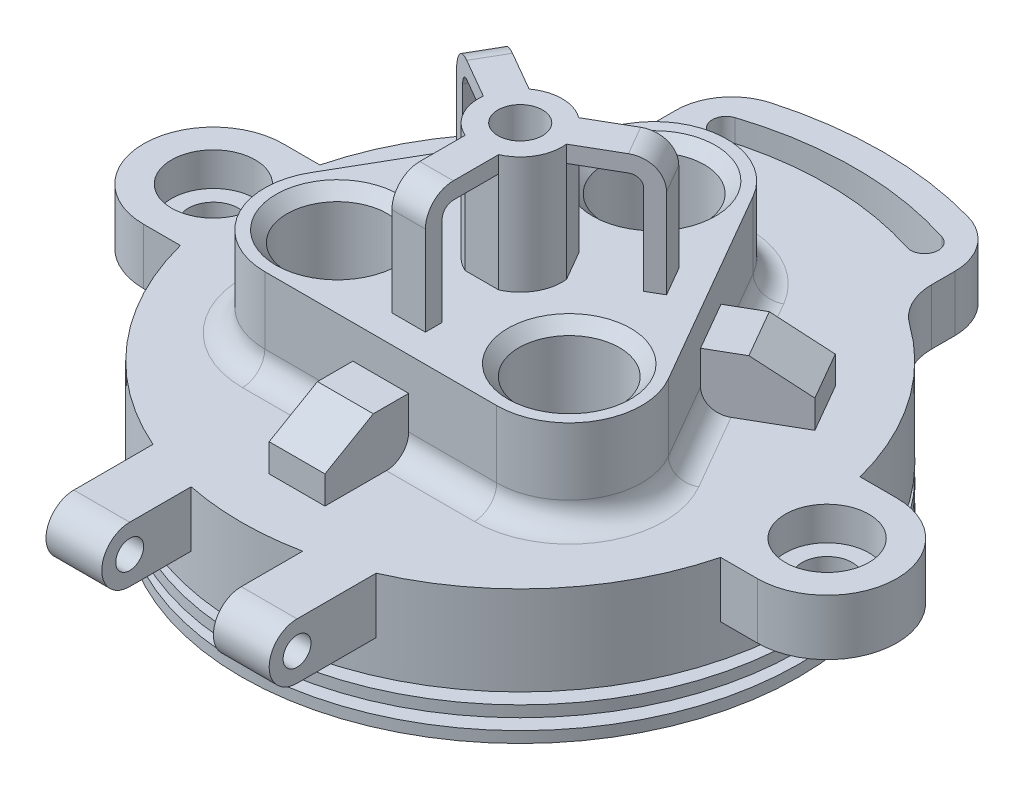
from build123d import *
from build123d.topology import SkipClean

# Parameters (mm, degrees)
BOSS_EXTRUDE1_DEPTH                              = 10
SKETCH3_R                                        = 9
BOSS_EXTRUDE2_DEPTH                              = 16
FILLET1_R                                        = 4
CHAMFER1_SIZE                                    = 2
BOSS_EXTRUDE3_START                              = 10
SKETCH5_R                                        = 13
BOSS_EXTRUDE3_DEPTH                              = 10
CUT_EXTRUDE1_DEPTH                               = 94.03897033
CUT_EXTRUDE1_DEPTH_BACK                          = 94.03897033
SKETCH4_R                                        = 9
CIRPATTERN1_COUNT                                = 3
CUT_EXTRUDE2_DEPTH                               = 94.03897033
CUT_EXTRUDE2_DEPTH_BACK                          = 94.03897033
SKETCH7_R                                        = 9
CBORE_FOR_M8_HEX_HEAD_MACHINE_SCREW1_D           = 9
CBORE_FOR_M8_HEX_HEAD_MACHINE_SCREW1_CBORE_D     = 15
CBORE_FOR_M8_HEX_HEAD_MACHINE_SCREW1_CBORE_DEPTH = 6
SKETCH11_W                                       = 3
SKETCH11_H                                       = 2
BOSS_EXTRUDE4_DEPTH                              = 5
CIRPATTERN2_COUNT                                = 3
SKETCH14_R                                       = 2.5
BOSS_EXTRUDE5_DEPTH                              = 10
BOSS_EXTRUDE6_START                              = -10
BOSS_EXTRUDE6_DEPTH                              = 10
SKETCH16_R                                       = 7.5
BOSS_EXTRUDE7_DEPTH                              = 21
CUT_EXTRUDE4_DEPTH                               = 112.813460728
CUT_EXTRUDE4_DEPTH_BACK                          = 112.813460728
SKETCH17_R                                       = 4
BOSS_EXTRUDE9_DEPTH                              = 3
CUT_EXTRUDE5_DEPTH                               = 3
CIRPATTERN3_COUNT                                = 3
FILLET6_R                                        = 10
FILLET7_R                                        = 10
FILLET8_R                                        = 10
FILLET9_R                                        = 10


with BuildPart() as part:
    # Sketch1 → Revolve1 (revolve)
    with BuildSketch(Plane.XY, mode=Mode.PRIVATE) as revolve1_sk:
        Polygon((0, 0), (50, 0), (50, -24), (45, -24), (45, -9), (0, -9), align=None)
    revolve(revolve1_sk.sketch.rotate(Axis((0, -30.388235294, 0), (0, 1, 0)), 90), axis=Axis((0, -30.388235294, 0), (0, 1, 0)))

    # Sketch2 → Boss-Extrude1 (add)
    with BuildSketch(Plane(origin=(0, 0, 0), x_dir=(1, 0, 0), z_dir=(0, 1, 0))):
        with BuildLine():
            Line((-48.412291828, 12.5), (-55, 12.5))
            ThreePointArc((-55, 12.5), (-67.5, 0), (-55, -12.5))
            Line((-55, -12.5), (-48.412291828, -12.5))
            Line((-48.412291828, -12.5), (-48.412291828, 12.5))
        make_face()
        with BuildLine():
            Line((48.412291828, -12.5), (48.412291828, 12.5))
            Line((48.412291828, 12.5), (55, 12.5))
            ThreePointArc((55, 12.5), (67.5, 0), (55, -12.5))
            Line((55, -12.5), (48.412291828, -12.5))
        make_face()
    extrude(amount=-BOSS_EXTRUDE1_DEPTH)

    # Sketch3 → Boss-Extrude2 (add)
    with BuildSketch(Plane(origin=(0, 0, 0), x_dir=(1, 0, 0), z_dir=(0, 1, 0))):
        with BuildLine():
            Line((32.04293994, -5.5), (11.258330249, 30.5))
            ThreePointArc((11.258330249, 30.5), (0, 37), (-11.258330249, 30.5))
            Line((-11.258330249, 30.5), (-32.04293994, -5.5))
            ThreePointArc((-32.04293994, -5.5), (-32.04293994, -18.5), (-20.784609691, -25))
            Line((-20.784609691, -25), (20.784609691, -25))
            ThreePointArc((20.784609691, -25), (32.04293994, -18.5), (32.04293994, -5.5))
        make_face()
        with Locations(Location((0, 24, 0), (0, 0, 270))):
            Circle(SKETCH3_R, mode=Mode.SUBTRACT)
        with Locations(Location((20.784609691, -12, 0), (0, 0, 270))):
            Circle(SKETCH3_R, mode=Mode.SUBTRACT)
        with Locations(Location((-20.784609691, -12, 0), (0, 0, 270))):
            Circle(SKETCH3_R, mode=Mode.SUBTRACT)
    extrude(amount=BOSS_EXTRUDE2_DEPTH)

    # Fillet1
    fillet1_edges = [part.edges().sort_by_distance(p)[0] for p in [
        (0, 0, -37),
        (-21.650635095, 0, -12.5),
        (-32.04293994, 0, 18.5),
        (0, 0, 25),
        (32.04293994, 0, 18.5),
        (21.650635095, 0, -12.5),
    ]]
    fillet(fillet1_edges, radius=FILLET1_R)

    # Chamfer1
    chamfer1_edges = [part.edges().sort_by_distance(p)[0] for p in [
        (20.784609691, 16, 3),
        (0, 16, -33),
        (-20.784609691, 16, 3),
    ]]
    chamfer(chamfer1_edges, length=CHAMFER1_SIZE)

    # Sketch5 → Boss-Extrude3 (add)
    with BuildSketch(Plane.XZ.offset(9).offset(BOSS_EXTRUDE3_START)):
        with Locations(Location((-20.784609691, 12, 0), (0, 0, 270))):
            Circle(SKETCH5_R)
    boss_extrude3 = extrude(amount=-BOSS_EXTRUDE3_DEPTH)

    # Sketch4 → Cut-Extrude1 (cut, two sides: drawn at the far end of the back side and taken through both)
    with SkipClean():  # the faces are left unmerged after this step: merging them gives an invalid solid
        with BuildSketch(Plane(origin=(0, 16, 0), x_dir=(1, 0, 0), z_dir=(0, 1, 0)).offset(-CUT_EXTRUDE1_DEPTH_BACK)):
            with Locations(Location((0, 24, 0), (0, 0, 90))):
                Circle(SKETCH4_R)
            with Locations(Location((20.784609691, -12, 0), (0, 0, 90))):
                Circle(SKETCH4_R)
            with Locations(Location((-20.784609691, -12, 0), (0, 0, 90))):
                Circle(SKETCH4_R)
        extrude(amount=CUT_EXTRUDE1_DEPTH + CUT_EXTRUDE1_DEPTH_BACK, mode=Mode.SUBTRACT)

    # CirPattern1: Boss-Extrude3 ×3 about axis
    with SkipClean():  # the faces are left unmerged after this step: merging them gives an invalid solid
        cirpattern1_axis = Axis((0, 0, 0), (0, 1, 0))
        for i in range(1, CIRPATTERN1_COUNT):
            add(boss_extrude3.rotate(cirpattern1_axis, i * 360 / CIRPATTERN1_COUNT))

    # Sketch7 → Cut-Extrude2 (cut, two sides: drawn at the far end of the back side and taken through both)
    with SkipClean():  # the faces are left unmerged after this step: merging them gives an invalid solid
        with BuildSketch(Plane(origin=(0, 16, 0), x_dir=(1, 0, 0), z_dir=(0, 1, 0)).offset(-CUT_EXTRUDE2_DEPTH_BACK)):
            with Locations(Location((0, 24, 0), (0, 0, 90))):
                Circle(SKETCH7_R)
            with Locations(Location((20.784609691, -12, 0), (0, 0, 90))):
                Circle(SKETCH7_R)
        extrude(amount=CUT_EXTRUDE2_DEPTH + CUT_EXTRUDE2_DEPTH_BACK, mode=Mode.SUBTRACT)

    # CBORE for M8 Hex Head Machine Screw1 (through all)
    with Locations(Plane(origin=(0, 0, 0), x_dir=(1, 0, 0), z_dir=(0, 1, 0))):
        with Locations((-55, 0), (55, 0)):
            CounterBoreHole(CBORE_FOR_M8_HEX_HEAD_MACHINE_SCREW1_D / 2, CBORE_FOR_M8_HEX_HEAD_MACHINE_SCREW1_CBORE_D / 2, CBORE_FOR_M8_HEX_HEAD_MACHINE_SCREW1_CBORE_DEPTH)

    # Sketch11 → Cut-Revolve1 (revolve, cut)
    with SkipClean():  # the faces are left unmerged after this step: merging them gives an invalid solid
        with BuildSketch(Plane.XY, mode=Mode.PRIVATE) as cut_revolve1_sk:
            with Locations((-48.5, -17)):
                Rectangle(SKETCH11_W, SKETCH11_H)
            with Locations((-48.5, -21)):
                Rectangle(SKETCH11_W, SKETCH11_H)
        revolve(cut_revolve1_sk.sketch.rotate(Axis((0, 0, 0), (0, -1, 0)), 270), axis=Axis((0, 0, 0), (0, -1, 0)), mode=Mode.SUBTRACT)

    # Sketch12 → Boss-Extrude4 (add, symmetric)
    with SkipClean():  # the faces are left unmerged after this step: merging them gives an invalid solid
        with BuildSketch(Plane(origin=(0, 0, 0), x_dir=(0, 0, -1), z_dir=(1, 0, 0))):
            Polygon((-25, 10), (-31.339745962, 10), (-40, 5), (-40, 0), (-25, 0), align=None)
        boss_extrude4 = extrude(amount=BOSS_EXTRUDE4_DEPTH, both=True)

    # CirPattern2: Boss-Extrude4 ×3 about axis
    with SkipClean():  # the faces are left unmerged after this step: merging them gives an invalid solid
        cirpattern2_axis = Axis((0, 0, 0), (0, 1, 0))
        for i in range(1, CIRPATTERN2_COUNT):
            add(boss_extrude4.rotate(cirpattern2_axis, i * 360 / CIRPATTERN2_COUNT))

    # Sketch14 → Boss-Extrude5 (add)
    with SkipClean():  # the faces are left unmerged after this step: merging them gives an invalid solid
        with BuildSketch(Plane(origin=(10, 0, 0), x_dir=(0, 0, -1), z_dir=(1, 0, 0))):
            with BuildLine():
                Line((-60, 0), (-45, 0))
                Line((-45, 0), (-45, -10))
                Line((-45, -10), (-60, -10))
                ThreePointArc((-60, -10), (-65, -5), (-60, 0))
            make_face()
            with Locations((-60, -5)):
                Circle(SKETCH14_R, mode=Mode.SUBTRACT)
        boss_extrude5 = extrude(amount=BOSS_EXTRUDE5_DEPTH)

    # Mirror1: Boss-Extrude5 across plane
    with SkipClean():  # the faces are left unmerged after this step: merging them gives an invalid solid
        add(boss_extrude5.mirror(Plane(origin=(0, 0, 0), x_dir=(0, 0, 1), z_dir=(1, 0, 0))))

    # Sketch15 → Boss-Extrude6 (add)
    with SkipClean():  # the faces are left unmerged after this step: merging them gives an invalid solid
        with BuildSketch(Plane(origin=(0, 0, 0), x_dir=(1, 0, 0), z_dir=(0, 1, 0)).offset(BOSS_EXTRUDE6_START)):
            with BuildLine():
                Line((-25, 43.301270189), (-25, 60))
                ThreePointArc((-25, 60), (0, 65), (25, 60))
                Line((25, 60), (25, 43.301270189))
                ThreePointArc((25, 43.301270189), (0, 50), (-25, 43.301270189))
            make_face()
            with BuildLine():
                ThreePointArc((18.541019662, 57.063390978), (0, 60), (-18.541019662, 57.063390978))
                ThreePointArc((-18.541019662, 57.063390978), (-20.146118467, 53.913207201), (-16.995934691, 52.308108396))
                ThreePointArc((-16.995934691, 52.308108396), (0, 55), (16.995934691, 52.308108396))
                ThreePointArc((16.995934691, 52.308108396), (20.146118467, 53.913207201), (18.541019662, 57.063390978))
            make_face(mode=Mode.SUBTRACT)
        extrude(amount=BOSS_EXTRUDE6_DEPTH)

    # Sketch16 → Boss-Extrude7 (add)
    with SkipClean():  # the faces are left unmerged after this step: merging them gives an invalid solid
        with BuildSketch(Plane(origin=(0, 16, 0), x_dir=(1, 0, 0), z_dir=(0, 1, 0))):
            with Locations(Location((0, 0, 0), (0, 0, 90))):
                Circle(SKETCH16_R)
        extrude(amount=BOSS_EXTRUDE7_DEPTH)

    # Sketch17 → Cut-Extrude4 (cut, two sides: drawn at the far end of the back side and taken through both)
    with SkipClean():  # the faces are left unmerged after this step: merging them gives an invalid solid
        with BuildSketch(Plane(origin=(0, 37, 0), x_dir=(1, 0, 0), z_dir=(0, 1, 0)).offset(-CUT_EXTRUDE4_DEPTH_BACK)):
            with Locations(Location((0, 0, 0), (0, 0, 270))):
                Circle(SKETCH17_R)
        extrude(amount=CUT_EXTRUDE4_DEPTH + CUT_EXTRUDE4_DEPTH_BACK, mode=Mode.SUBTRACT)

    # Sketch19 → Boss-Extrude9 (add, symmetric)
    with SkipClean():  # the faces are left unmerged after this step: merging them gives an invalid solid
        with BuildSketch(Plane(origin=(0, 0, 0), x_dir=(0, 0, -1), z_dir=(1, 0, 0))):
            with BuildLine():
                Line((-5.5, 37), (-15, 37))
                ThreePointArc((-15, 37), (-18.535533906, 35.535533906), (-20, 32))
                Line((-20, 32), (-20, 15.631109771))
                Line((-20, 15.631109771), (-17, 15.631109771))
                Line((-17, 15.631109771), (-17, 32))
                ThreePointArc((-17, 32), (-16.414213562, 33.414213562), (-15, 34))
                Line((-15, 34), (-5.5, 34))
                Line((-5.5, 34), (-5.5, 37))
            make_face()
        boss_extrude9 = extrude(amount=BOSS_EXTRUDE9_DEPTH, both=True)

    # Sketch21 → Cut-Extrude5 (cut, symmetric)
    with SkipClean():  # the faces are left unmerged after this step: merging them gives an invalid solid
        with BuildSketch(Plane(origin=(0, 0, 0), x_dir=(0, 0, -1), z_dir=(1, 0, 0))):
            with BuildLine():
                Line((-17, 16), (-17, 32))
                ThreePointArc((-17, 32), (-16.414213562, 33.414213562), (-15, 34))
                Line((-15, 34), (-6.873863542, 34))
                Line((-6.873863542, 34), (-6.873863542, 16))
                Line((-6.873863542, 16), (-17, 16))
            make_face()
        cut_extrude5 = extrude(amount=CUT_EXTRUDE5_DEPTH, both=True, mode=Mode.SUBTRACT)

    # CirPattern3: Boss-Extrude9, Cut-Extrude5 ×3 about axis
    with SkipClean():  # the faces are left unmerged after this step: merging them gives an invalid solid
        cirpattern3_axis = Axis((0, 0, 0), (0, 1, 0))
        add([boss_extrude9.rotate(cirpattern3_axis, i * 360 / CIRPATTERN3_COUNT) for i in range(1, CIRPATTERN3_COUNT)])
        add([cut_extrude5.rotate(cirpattern3_axis, i * 360 / CIRPATTERN3_COUNT) for i in range(1, CIRPATTERN3_COUNT)], mode=Mode.SUBTRACT)

    # Fillet6
    fillet6_edges = [part.edges().sort_by_distance(p)[0] for p in [
        (25, -5, -43.301270189),
    ]]
    fillet(fillet6_edges, radius=FILLET6_R)

    # Fillet7
    fillet7_edges = [part.edges().sort_by_distance(p)[0] for p in [
        (25, -5, -60),
    ]]
    fillet(fillet7_edges, radius=FILLET7_R)

    # Fillet8
    fillet8_edges = [part.edges().sort_by_distance(p)[0] for p in [
        (-25, -5, -60),
    ]]
    fillet(fillet8_edges, radius=FILLET8_R)

    # Fillet9
    fillet9_edges = [part.edges().sort_by_distance(p)[0] for p in [
        (-25, -5, -43.301270189),
    ]]
    fillet(fillet9_edges, radius=FILLET9_R)


solid = part.part
